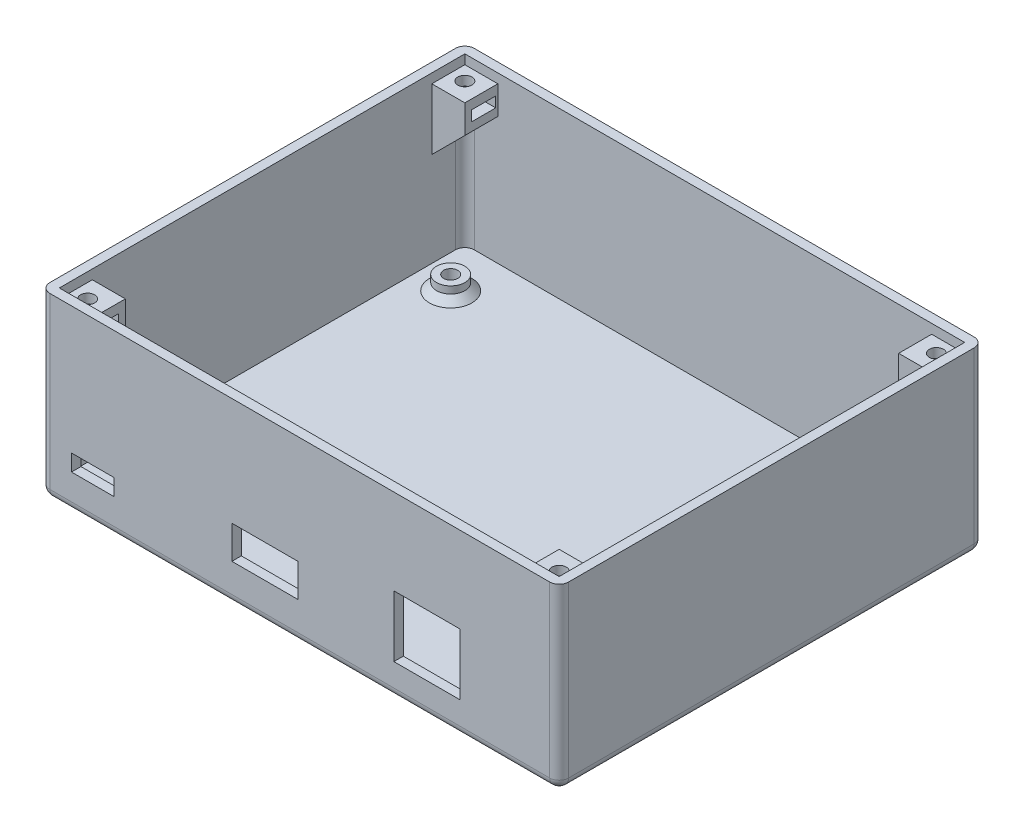
from build123d import *

# Parameters (mm, degrees)
SKETCH1_W               = 110
SKETCH1_H               = 90
BOSS_EXTRUDE1_DEPTH     = 3
SKETCH2_W               = 110
SKETCH2_H               = 90
SKETCH2_W_2             = 106
SKETCH2_H_2             = 86
BOSS_EXTRUDE2_DEPTH     = 35
SKETCH3_R               = 3
BOSS_EXTRUDE3_DEPTH     = 3
SKETCH4_R               = 1.5
CUT_EXTRUDE1_DEPTH      = 78.935871074
CUT_EXTRUDE2_DEPTH      = 2.3
CUT_EXTRUDE3_REACH      = 114.112
SKETCH6_W               = 9
SKETCH6_H               = 3.5
SKETCH6_W_2             = 14
SKETCH6_H_2             = 13
SKETCH6_H_3             = 7
FILLET2_R               = 2
SKETCH7_W               = 7
SKETCH7_H               = 7
BOSS_EXTRUDE4_DEPTH     = 6
CUT_EXTRUDE4_DEPTH      = 2.2
SKETCH10_R              = 1.5
CUT_EXTRUDE5_DEPTH      = 5
CHAMFER2_SIZE           = 7
MIRROR4_COPY_1_SKETCH_W = 7
MIRROR4_COPY_1_SKETCH_H = 7
MIRROR4_COPY_1_DEPTH    = 6
MIRROR4_COPY_2_DEPTH    = 2.2
MIRROR4_COPY_3_SKETCH_R = 1.5
MIRROR4_COPY_3_DEPTH    = 5
CHAMFER3_SIZE           = 7
CHAMFER4_SIZE           = 7
FILLET6_R               = 2
CHAMFER5_SIZE           = 1.5


with BuildPart() as part:
    # Sketch1 → Boss-Extrude1 (new body)
    with BuildSketch(Plane(origin=(0, 0, 0), x_dir=(1, 0, 0), z_dir=(0, 1, 0))):
        Rectangle(SKETCH1_W, SKETCH1_H)
    extrude(amount=BOSS_EXTRUDE1_DEPTH)

    # Sketch2 → Boss-Extrude2 (add)
    with BuildSketch(Plane(origin=(0, 3, 0), x_dir=(1, 0, 0), z_dir=(0, 1, 0))):
        Rectangle(SKETCH2_W, SKETCH2_H)
        Rectangle(SKETCH2_W_2, SKETCH2_H_2, mode=Mode.SUBTRACT)
    extrude(amount=BOSS_EXTRUDE2_DEPTH)

    # Sketch3 → Boss-Extrude3 (add)
    with BuildSketch(Plane(origin=(0, 3, 0), x_dir=(1, 0, 0), z_dir=(0, 1, 0))):
        with Locations(Location((-46, 33, 0), (0, 0, 270))):
            Circle(SKETCH3_R)
        with Locations(Location((40, 33, 0), (0, 0, 270))):
            Circle(SKETCH3_R)
        with Locations(Location((-46, -25, 0), (0, 0, 270))):
            Circle(SKETCH3_R)
        with Locations(Location((40, -25, 0), (0, 0, 270))):
            Circle(SKETCH3_R)
    extrude(amount=BOSS_EXTRUDE3_DEPTH)

    # Sketch4 → Cut-Extrude1 (cut, through all)
    with BuildSketch(Plane(origin=(0, 6, 0), x_dir=(1, 0, 0), z_dir=(0, 1, 0))):
        with Locations(Location((-46, 33, 0), (0, 0, 270))):
            Circle(SKETCH4_R)
        with Locations(Location((40, 33, 0), (0, 0, 270))):
            Circle(SKETCH4_R)
        with Locations(Location((40, -25, 0), (0, 0, 270))):
            Circle(SKETCH4_R)
        with Locations(Location((-46, -25, 0), (0, 0, 270))):
            Circle(SKETCH4_R)
    extrude(amount=-CUT_EXTRUDE1_DEPTH, mode=Mode.SUBTRACT)

    # Sketch5 → Cut-Extrude2 (cut)
    with BuildSketch(Plane.XZ):
        Polygon((37.45, 26.472243186), (37.45, 23.527756814), (40, 22.055513627), (42.55, 23.527756814), (42.55, 26.472243186), (40, 27.944486373), align=None)
        Polygon((-46, 27.944486373), (-48.55, 26.472243186), (-48.55, 23.527756814), (-46, 22.055513627), (-43.45, 23.527756814), (-43.45, 26.472243186), align=None)
        Polygon((-48.55, -34.472243186), (-46, -35.944486373), (-43.45, -34.472243186), (-43.45, -31.527756814), (-46, -30.055513627), (-48.55, -31.527756814), align=None)
        Polygon((42.55, -34.472243186), (42.55, -31.527756814), (40, -30.055513627), (37.45, -31.527756814), (37.45, -34.472243186), (40, -35.944486373), align=None)
    extrude(amount=-CUT_EXTRUDE2_DEPTH, mode=Mode.SUBTRACT)

    # Sketch6 → Cut-Extrude3 (cut, up to next)
    with BuildSketch(Plane.XY.offset(45), mode=Mode.PRIVATE) as cut_extrude3_sk1:
        with Locations((-43.919999919, 9.236200323)):
            Rectangle(SKETCH6_W, SKETCH6_H)
    cut_extrude3_tool1 = extrude(cut_extrude3_sk1.sketch, amount=-CUT_EXTRUDE3_REACH, mode=Mode.PRIVATE) & part.part
    # Sketch6 → Cut-Extrude3 (cut, up to next)
    with BuildSketch(Plane.XY.offset(45), mode=Mode.PRIVATE) as cut_extrude3_sk2:
        with Locations((26.950000009, 13.355009857)):
            Rectangle(SKETCH6_W_2, SKETCH6_H_2)
    cut_extrude3_tool2 = extrude(cut_extrude3_sk2.sketch, amount=-CUT_EXTRUDE3_REACH, mode=Mode.PRIVATE) & part.part
    # Sketch6 → Cut-Extrude3 (cut, up to next)
    with BuildSketch(Plane.XY.offset(45), mode=Mode.PRIVATE) as cut_extrude3_sk3:
        with Locations((-7.4, 11.595)):
            Rectangle(SKETCH6_W_2, SKETCH6_H_3)
    cut_extrude3_tool3 = extrude(cut_extrude3_sk3.sketch, amount=-CUT_EXTRUDE3_REACH, mode=Mode.PRIVATE) & part.part
    add(cut_extrude3_tool1.solids().sort_by_distance((-43.92, 9.2362, 45))[0], mode=Mode.SUBTRACT)
    add(cut_extrude3_tool2.solids().sort_by_distance((26.95, 13.35501, 45))[0], mode=Mode.SUBTRACT)
    add(cut_extrude3_tool3.solids().sort_by_distance((-7.4, 11.595, 45))[0], mode=Mode.SUBTRACT)

    # Fillet2
    fillet2_edges = [part.edges().sort_by_distance(p)[0] for p in [
        (0, 0, 45),
        (-55, 0, 0),
        (0, 0, -45),
        (55, 0, 0),
        (55, 19, 45),
        (-55, 19, 45),
        (-55, 19, -45),
        (55, 19, -45),
    ]]
    fillet(fillet2_edges, radius=FILLET2_R)

    # Sketch7 → Boss-Extrude4 (add)
    with BuildSketch(Plane(origin=(0, 36, 0), x_dir=(1, 0, 0), z_dir=(0, 1, 0))):
        with Locations((-49.5, 39.5)):
            Rectangle(SKETCH7_W, SKETCH7_H)
    boss_extrude4 = extrude(amount=-BOSS_EXTRUDE4_DEPTH)

    # Sketch8 → Cut-Extrude4 (cut)
    with BuildSketch(Plane(origin=(0, 34, 0), x_dir=(1, 0, 0), z_dir=(0, 1, 0))):
        Polygon((-48.527756814, 42.55), (-51.472243186, 42.55), (-52.944486373, 40), (-51.472243186, 37.45), (-48.527756814, 37.45), (-46, 37.45), (-46, 42.55), align=None)
    cut_extrude4 = extrude(amount=-CUT_EXTRUDE4_DEPTH, mode=Mode.SUBTRACT)

    # Sketch10 → Cut-Extrude5 (cut)
    with BuildSketch(Plane(origin=(0, 36, 0), x_dir=(1, 0, 0), z_dir=(0, 1, 0))):
        with Locations(Location((-50, 40, 0), (0, 0, 270))):
            Circle(SKETCH10_R)
    cut_extrude5 = extrude(amount=-CUT_EXTRUDE5_DEPTH, mode=Mode.SUBTRACT)

    # Chamfer2
    chamfer2_edges = [part.edges().sort_by_distance(p)[0] for p in [
        (-53, 30, -39.5),
    ]]
    chamfer(chamfer2_edges, length=CHAMFER2_SIZE - 0.0001)  # a hair under: the kernel refuses the full size

    # Mirror3: Boss-Extrude4, Cut-Extrude4, Cut-Extrude5 across plane
    add(boss_extrude4.mirror(Plane(origin=(0, 0, 0), x_dir=(0, 0, 1), z_dir=(1, 0, 0))))
    add(cut_extrude4.mirror(Plane(origin=(0, 0, 0), x_dir=(0, 0, 1), z_dir=(1, 0, 0))), mode=Mode.SUBTRACT)
    add(cut_extrude5.mirror(Plane(origin=(0, 0, 0), x_dir=(0, 0, 1), z_dir=(1, 0, 0))), mode=Mode.SUBTRACT)

    # Mirror4: Boss-Extrude4, Cut-Extrude4, Cut-Extrude5 across plane
    add(boss_extrude4.mirror(Plane.XY))
    add(cut_extrude4.mirror(Plane.XY), mode=Mode.SUBTRACT)
    add(cut_extrude5.mirror(Plane.XY), mode=Mode.SUBTRACT)

    # Mirror4 copy 1 sketch → Mirror4 copy 1 (add)
    with BuildSketch(Plane(origin=(0, 36, 0), x_dir=(-1, 0, 0), z_dir=(0, 1, 0))):
        with Locations((-49.5, 39.5)):
            Rectangle(MIRROR4_COPY_1_SKETCH_W, MIRROR4_COPY_1_SKETCH_H)
    extrude(amount=-MIRROR4_COPY_1_DEPTH)

    # Mirror4 copy 2 sketch → Mirror4 copy 2 (cut)
    with BuildSketch(Plane(origin=(0, 34, 0), x_dir=(-1, 0, 0), z_dir=(0, 1, 0))):
        Polygon((-48.527756814, 42.55), (-51.472243186, 42.55), (-52.944486373, 40), (-51.472243186, 37.45), (-48.527756814, 37.45), (-46, 37.45), (-46, 42.55), align=None)
    extrude(amount=-MIRROR4_COPY_2_DEPTH, mode=Mode.SUBTRACT)

    # Mirror4 copy 3 sketch → Mirror4 copy 3 (cut)
    with BuildSketch(Plane(origin=(0, 36, 0), x_dir=(-1, 0, 0), z_dir=(0, 1, 0))):
        with Locations(Location((-50, 40, 0), (0, 0, 270))):
            Circle(MIRROR4_COPY_3_SKETCH_R)
    extrude(amount=-MIRROR4_COPY_3_DEPTH, mode=Mode.SUBTRACT)

    # Chamfer3
    chamfer3_edges = [part.edges().sort_by_distance(p)[0] for p in [
        (53, 30, -39.5),
    ]]
    chamfer(chamfer3_edges, length=CHAMFER3_SIZE - 0.0001)  # a hair under: the kernel refuses the full size

    # Chamfer4
    chamfer4_edges = [part.edges().sort_by_distance(p)[0] for p in [
        (-53, 30, 39.5),
        (53, 30, 39.5),
    ]]
    chamfer(chamfer4_edges, length=CHAMFER4_SIZE - 0.0001)  # a hair under: the kernel refuses the full size

    # Fillet6
    fillet6_edges = [part.edges().sort_by_distance(p)[0] for p in [
        (-53, 13.00005, -43),
        (53, 13.00005, -43),
        (-53, 13.00005, 43),
        (53, 13.00005, 43),
    ]]
    fillet(fillet6_edges, radius=FILLET6_R)

    # Chamfer5
    chamfer5_edges = [part.edges().sort_by_distance(p)[0] for p in [
        (-46, 3, -36),
        (40, 3, -36),
        (40, 3, 22),
        (-46, 3, 22),
    ]]
    chamfer(chamfer5_edges, length=CHAMFER5_SIZE)


solid = part.part
